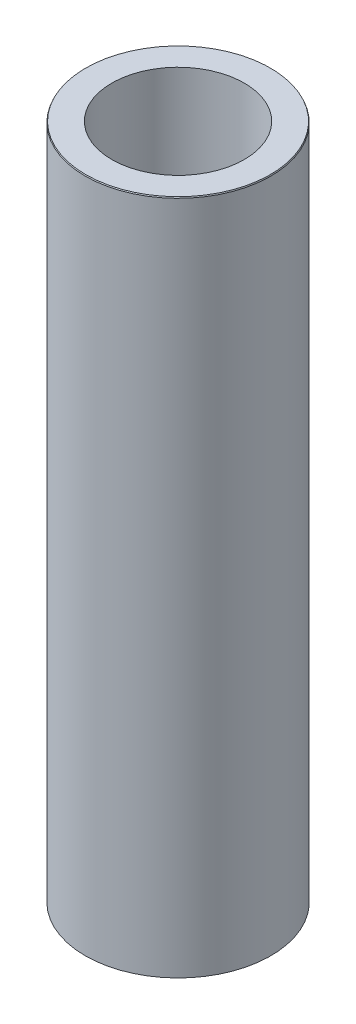
from build123d import *
from OCP.BRepFilletAPI import BRepFilletAPI_MakeChamfer

# Parameters (mm, degrees)
SKETCH1_R           = 55
BOSS_EXTRUDE1_DEPTH = 401.184286263
SKETCH2_R           = 39.281531267
CUT_EXTRUDE1_DEPTH  = 409.654905201
CHAMFER1_SIZE       = 0.652497027
CHAMFER1_SIZE2      = 0.277147951


with BuildPart() as part:
    # Sketch1 → Boss-Extrude1 (new body)
    with BuildSketch(Plane(origin=(0, 0, 0), x_dir=(1, 0, 0), z_dir=(0, 1, 0))):
        Circle(SKETCH1_R)
    extrude(amount=BOSS_EXTRUDE1_DEPTH)

    # Sketch2 → Cut-Extrude1 (cut, through all)
    with BuildSketch(Plane(origin=(0, 0, 0), x_dir=(1, 0, 0), z_dir=(0, 1, 0))):
        Circle(SKETCH2_R)
    extrude(amount=CUT_EXTRUDE1_DEPTH, mode=Mode.SUBTRACT)

    # Chamfer1: one chamfer whose edges measure the first distance from different faces: ONE call of the kernel's chamfer builder (chamfer() names one face for all edges)
    chamfer1_edges_1 = [part.edges().sort_by_distance(p)[0] for p in [
        (-55, 401.184286263, 0),
    ]]
    chamfer1_side_1 = [part.faces().sort_by_distance(p)[0] for p in [
        (-55, 200.592143132, 0),
    ]]
    chamfer1_edges_2 = [part.edges().sort_by_distance(p)[0] for p in [
        (-55, 0, 0),
    ]]
    chamfer1_side_2 = [part.faces().sort_by_distance(p)[0] for p in [
        (-53.444365081, 0, 0),
    ]]
    chamfer1 = BRepFilletAPI_MakeChamfer(part.part.solid().wrapped)
    for e in chamfer1_edges_1:
        chamfer1.Add(CHAMFER1_SIZE, CHAMFER1_SIZE2, e.wrapped, chamfer1_side_1[0].wrapped)  # the first distance lies on this face
    for e in chamfer1_edges_2:
        chamfer1.Add(CHAMFER1_SIZE, CHAMFER1_SIZE2, e.wrapped, chamfer1_side_2[0].wrapped)  # the first distance lies on this face
    add(Compound.cast(chamfer1.Shape()), mode=Mode.REPLACE)


solid = part.part
